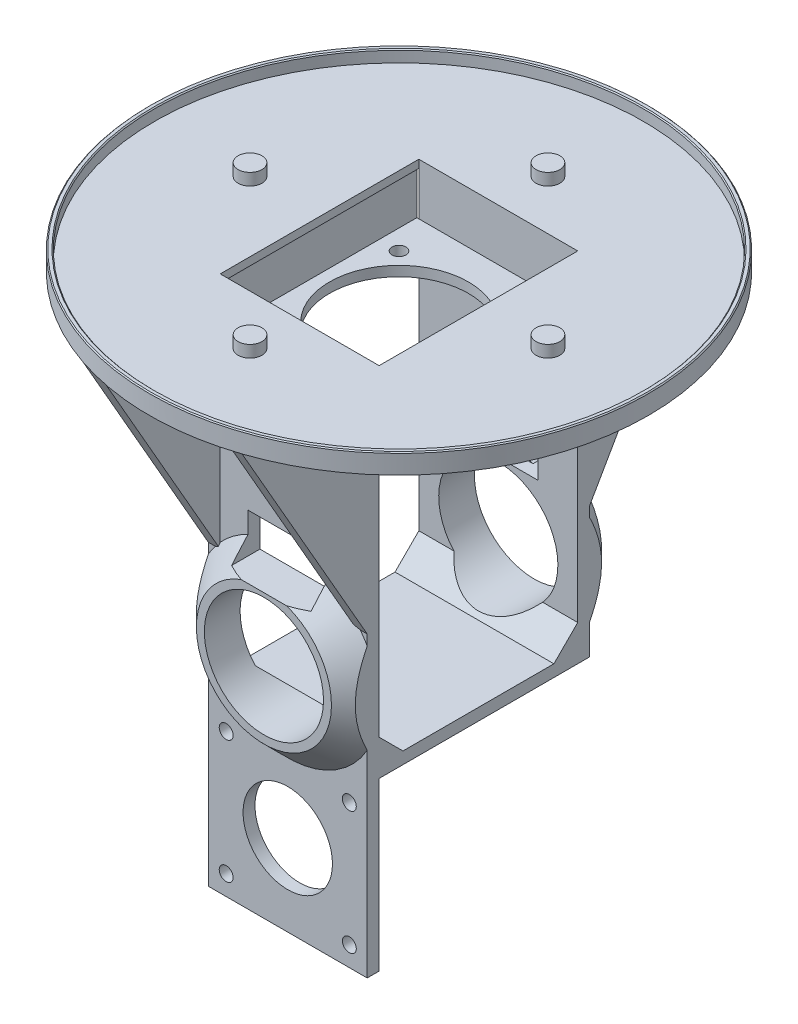
from build123d import *

# Parameters (mm, degrees)
SKETCH1_R            = 62.775
SKETCH1_R_2          = 2.75
BOSS_EXTRUDE1_DEPTH  = 2
SKETCH2_R            = 62.775
SKETCH2_R_2          = 61.525
SKETCH2_R_3          = 3
BOSS_EXTRUDE2_DEPTH  = 3
CHAMFER1_SIZE        = 0.25
BOSS_EXTRUDE3_START  = 25
SKETCH3_W            = 40
SKETCH3_H            = 130
BOSS_EXTRUDE3_DEPTH  = 3
CUT_EXTRUDE1_REACH   = 172.531
SKETCH4_R            = 1.75
SKETCH4_R_2          = 11.25
BOSS_EXTRUDE4_DEPTH  = 3
LPATTERN1_COUNT      = 2
LPATTERN1_PITCH      = 37
BOSS_EXTRUDE6_DEPTH  = 50
CUT_EXTRUDE2_REACH   = 148.471
SKETCH8_R            = 17.5
SKETCH8_R_2          = 1.75
CUT_EXTRUDE3_REACH   = 161.077
SKETCH9_W            = 40
SKETCH9_H            = 50
MIRROR1_COPY_1_DEPTH = 3
CUT_EXTRUDE4_REACH   = 172.531
SKETCH10_R           = 15
SKETCH10_W           = 40
SKETCH10_H           = 45
SKETCH11_W           = 40
SKETCH11_H           = 56
BOSS_EXTRUDE7_DEPTH  = 3
SKETCH12_R           = 15
CUT_EXTRUDE5_DEPTH   = 171.530939275
SKETCH13_R           = 17
SKETCH13_R_2         = 15
BOSS_EXTRUDE9_DEPTH  = 9
CHAMFER2_SIZE        = 6
SKETCH14_W           = 20
SKETCH14_H           = 10
CUT_EXTRUDE6_DEPTH   = 171.530939275
CHAMFER3_SIZE        = 6


with BuildPart() as part:
    # Sketch1 → Boss-Extrude1 (new body)
    with BuildSketch(Plane(origin=(0, 0, 0), x_dir=(1, 0, 0), z_dir=(0, 1, 0))):
        with Locations(Location((0, 0, 0), (0, 0, 270))):
            Circle(SKETCH1_R)
        with Locations(Location((0, 0, 0), (0, 0, 270))):
            Circle(SKETCH1_R_2, mode=Mode.SUBTRACT)
    extrude(amount=BOSS_EXTRUDE1_DEPTH)

    # Sketch2 → Boss-Extrude2 (add)
    # profile 1 of 5: a face of its own
    with BuildSketch(Plane(origin=(0, 2, 0), x_dir=(1, 0, 0), z_dir=(0, 1, 0))):
        with Locations(Location((0, 0, 0), (0, 0, 270))):
            Circle(SKETCH2_R)
        with Locations(Location((0, 0, 0), (0, 0, 270))):
            Circle(SKETCH2_R_2, mode=Mode.SUBTRACT)
    # profile 2 of 5: a face of its own
    with BuildSketch(Plane(origin=(0, 2, 0), x_dir=(1, 0, 0), z_dir=(0, 1, 0))):
        with Locations(Location((-37.5, 0, 0), (0, 0, 270))):
            Circle(SKETCH2_R_3)
    # profile 3 of 5: a face of its own
    with BuildSketch(Plane(origin=(0, 2, 0), x_dir=(1, 0, 0), z_dir=(0, 1, 0))):
        with Locations(Location((0, 37.5, 0), (0, 0, 270))):
            Circle(SKETCH2_R_3)
    # profile 4 of 5: a face of its own
    with BuildSketch(Plane(origin=(0, 2, 0), x_dir=(1, 0, 0), z_dir=(0, 1, 0))):
        with Locations(Location((37.5, 0, 0), (0, 0, 270))):
            Circle(SKETCH2_R_3)
    # profile 5 of 5: a face of its own
    with BuildSketch(Plane(origin=(0, 2, 0), x_dir=(1, 0, 0), z_dir=(0, 1, 0))):
        with Locations(Location((0, -37.5, 0), (0, 0, 270))):
            Circle(SKETCH2_R_3)
    extrude(amount=BOSS_EXTRUDE2_DEPTH)

    # Chamfer1
    chamfer1_edges = [part.edges().sort_by_distance(p)[0] for p in [
        (0, 5, -61.525),
        (0, 5, -62.775),
    ]]
    chamfer(chamfer1_edges, length=CHAMFER1_SIZE)

    # Sketch3 → Boss-Extrude3 (add)
    with BuildSketch(Plane.XY.offset(BOSS_EXTRUDE3_START)):
        with Locations((0, -65)):
            Rectangle(SKETCH3_W, SKETCH3_H)
    boss_extrude3 = extrude(amount=BOSS_EXTRUDE3_DEPTH)

    # Sketch4 → Cut-Extrude1 (cut, up to next)
    with BuildSketch(Plane.XY.offset(28), mode=Mode.PRIVATE) as cut_extrude1_sk1:
        with Locations((-15.5, -125)):
            Circle(SKETCH4_R)
    cut_extrude1_tool1 = extrude(cut_extrude1_sk1.sketch, amount=-CUT_EXTRUDE1_REACH, mode=Mode.PRIVATE) & part.part
    # Sketch4 → Cut-Extrude1 (cut, up to next)
    with BuildSketch(Plane.XY.offset(28), mode=Mode.PRIVATE) as cut_extrude1_sk2:
        with Locations((15.5, -125)):
            Circle(SKETCH4_R)
    cut_extrude1_tool2 = extrude(cut_extrude1_sk2.sketch, amount=-CUT_EXTRUDE1_REACH, mode=Mode.PRIVATE) & part.part
    # Sketch4 → Cut-Extrude1 (cut, up to next)
    with BuildSketch(Plane.XY.offset(28), mode=Mode.PRIVATE) as cut_extrude1_sk3:
        with Locations((15.5, -94)):
            Circle(SKETCH4_R)
    cut_extrude1_tool3 = extrude(cut_extrude1_sk3.sketch, amount=-CUT_EXTRUDE1_REACH, mode=Mode.PRIVATE) & part.part
    # Sketch4 → Cut-Extrude1 (cut, up to next)
    with BuildSketch(Plane.XY.offset(28), mode=Mode.PRIVATE) as cut_extrude1_sk4:
        with Locations((-15.5, -94)):
            Circle(SKETCH4_R)
    cut_extrude1_tool4 = extrude(cut_extrude1_sk4.sketch, amount=-CUT_EXTRUDE1_REACH, mode=Mode.PRIVATE) & part.part
    # Sketch4 → Cut-Extrude1 (cut, up to next)
    with BuildSketch(Plane.XY.offset(28), mode=Mode.PRIVATE) as cut_extrude1_sk5:
        with Locations((0, -109.5)):
            Circle(SKETCH4_R_2)
    cut_extrude1_tool5 = extrude(cut_extrude1_sk5.sketch, amount=-CUT_EXTRUDE1_REACH, mode=Mode.PRIVATE) & part.part
    add(cut_extrude1_tool1.solids().sort_by_distance((-15.5, -125, 28))[0], mode=Mode.SUBTRACT)
    add(cut_extrude1_tool2.solids().sort_by_distance((15.5, -125, 28))[0], mode=Mode.SUBTRACT)
    add(cut_extrude1_tool3.solids().sort_by_distance((15.5, -94, 28))[0], mode=Mode.SUBTRACT)
    add(cut_extrude1_tool4.solids().sort_by_distance((-15.5, -94, 28))[0], mode=Mode.SUBTRACT)
    add(cut_extrude1_tool5.solids().sort_by_distance((0, -109.5, 28))[0], mode=Mode.SUBTRACT)

    # Sketch5 → Boss-Extrude4 (add)
    with BuildSketch(Plane(origin=(20, 0, 0), x_dir=(0, 0, -1), z_dir=(1, 0, 0))):
        Polygon((-59.503786644, 0), (-28, 0), (-28, -55), align=None)
    boss_extrude4 = extrude(amount=-BOSS_EXTRUDE4_DEPTH)

    # LPattern1: Boss-Extrude4 ×2
    with Locations(*[(-i * LPATTERN1_PITCH, 0, 0) for i in range(1, LPATTERN1_COUNT)]):
        add(boss_extrude4)

    # Sketch7 → Boss-Extrude6 (add)
    with BuildSketch(Plane(origin=(0, 0, 25), x_dir=(-1, 0, 0), z_dir=(0, 0, -1))):
        Polygon((-22.5, -13.5), (22.5, -13.5), (22.5, 0), (20.5, 0), (20.5, -11), (-20.5, -11), (-20.5, 0), (-22.5, 0), align=None)
    extrude(amount=BOSS_EXTRUDE6_DEPTH)

    # Sketch8 → Cut-Extrude2 (cut, up to next)
    with BuildSketch(Plane.XZ.offset(13.5), mode=Mode.PRIVATE) as cut_extrude2_sk1:
        Circle(SKETCH8_R)
    cut_extrude2_tool1 = extrude(cut_extrude2_sk1.sketch, amount=-CUT_EXTRUDE2_REACH, mode=Mode.PRIVATE) & part.part
    # Sketch8 → Cut-Extrude2 (cut, up to next)
    with BuildSketch(Plane.XZ.offset(13.5), mode=Mode.PRIVATE) as cut_extrude2_sk2:
        with Locations((15.5, 15.5)):
            Circle(SKETCH8_R_2)
    cut_extrude2_tool2 = extrude(cut_extrude2_sk2.sketch, amount=-CUT_EXTRUDE2_REACH, mode=Mode.PRIVATE) & part.part
    # Sketch8 → Cut-Extrude2 (cut, up to next)
    with BuildSketch(Plane.XZ.offset(13.5), mode=Mode.PRIVATE) as cut_extrude2_sk3:
        with Locations((-15.5, 15.5)):
            Circle(SKETCH8_R_2)
    cut_extrude2_tool3 = extrude(cut_extrude2_sk3.sketch, amount=-CUT_EXTRUDE2_REACH, mode=Mode.PRIVATE) & part.part
    # Sketch8 → Cut-Extrude2 (cut, up to next)
    with BuildSketch(Plane.XZ.offset(13.5), mode=Mode.PRIVATE) as cut_extrude2_sk4:
        with Locations((-15.5, -15.5)):
            Circle(SKETCH8_R_2)
    cut_extrude2_tool4 = extrude(cut_extrude2_sk4.sketch, amount=-CUT_EXTRUDE2_REACH, mode=Mode.PRIVATE) & part.part
    # Sketch8 → Cut-Extrude2 (cut, up to next)
    with BuildSketch(Plane.XZ.offset(13.5), mode=Mode.PRIVATE) as cut_extrude2_sk5:
        with Locations((15.5, -15.5)):
            Circle(SKETCH8_R_2)
    cut_extrude2_tool5 = extrude(cut_extrude2_sk5.sketch, amount=-CUT_EXTRUDE2_REACH, mode=Mode.PRIVATE) & part.part
    add(cut_extrude2_tool1.solids().sort_by_distance((0, -13.5, 0))[0], mode=Mode.SUBTRACT)
    add(cut_extrude2_tool2.solids().sort_by_distance((15.5, -13.5, 15.5))[0], mode=Mode.SUBTRACT)
    add(cut_extrude2_tool3.solids().sort_by_distance((-15.5, -13.5, 15.5))[0], mode=Mode.SUBTRACT)
    add(cut_extrude2_tool4.solids().sort_by_distance((-15.5, -13.5, -15.5))[0], mode=Mode.SUBTRACT)
    add(cut_extrude2_tool5.solids().sort_by_distance((15.5, -13.5, -15.5))[0], mode=Mode.SUBTRACT)

    # Sketch9 → Cut-Extrude3 (cut, up to next)
    with BuildSketch(Plane(origin=(0, 2, 0), x_dir=(1, 0, 0), z_dir=(0, 1, 0)), mode=Mode.PRIVATE) as cut_extrude3_sk1:
        Rectangle(SKETCH9_W, SKETCH9_H)
    cut_extrude3_tool1 = extrude(cut_extrude3_sk1.sketch, amount=-CUT_EXTRUDE3_REACH, mode=Mode.PRIVATE) & part.part
    add(cut_extrude3_tool1.solids().sort_by_distance((0, 2, 0))[0], mode=Mode.SUBTRACT)

    # Mirror1: Boss-Extrude3, Boss-Extrude4 across plane
    add(boss_extrude3.mirror(Plane.XY))
    add(boss_extrude4.mirror(Plane.XY))

    # Mirror1 copy 1 sketch → Mirror1 copy 1 (add)
    with BuildSketch(Plane(origin=(-17, 0, 0), x_dir=(0, 0, 1), z_dir=(1, 0, 0))):
        Polygon((-59.503786644, 0), (-28, 0), (-28, 55), align=None)
    extrude(amount=-MIRROR1_COPY_1_DEPTH)

    # Sketch10 → Cut-Extrude4 (cut, up to next)
    with BuildSketch(Plane(origin=(0, 0, -28), x_dir=(-1, 0, 0), z_dir=(0, 0, -1)), mode=Mode.PRIVATE) as cut_extrude4_sk1:
        with Locations((0, -69)):
            Circle(SKETCH10_R)
    cut_extrude4_tool1 = extrude(cut_extrude4_sk1.sketch, amount=-CUT_EXTRUDE4_REACH, mode=Mode.PRIVATE) & part.part
    # Sketch10 → Cut-Extrude4 (cut, up to next)
    with BuildSketch(Plane(origin=(0, 0, -28), x_dir=(-1, 0, 0), z_dir=(0, 0, -1)), mode=Mode.PRIVATE) as cut_extrude4_sk2:
        with Locations((0, -107.5)):
            Rectangle(SKETCH10_W, SKETCH10_H)
    cut_extrude4_tool2 = extrude(cut_extrude4_sk2.sketch, amount=-CUT_EXTRUDE4_REACH, mode=Mode.PRIVATE) & part.part
    add(cut_extrude4_tool1.solids().sort_by_distance((0, -69, -28))[0], mode=Mode.SUBTRACT)
    add(cut_extrude4_tool2.solids().sort_by_distance((0, -107.5, -28))[0], mode=Mode.SUBTRACT)

    # Sketch11 → Boss-Extrude7 (add)
    with BuildSketch(Plane.XZ.offset(85)):
        Rectangle(SKETCH11_W, SKETCH11_H)
    extrude(amount=BOSS_EXTRUDE7_DEPTH)

    # Sketch12 → Cut-Extrude5 (cut, through all)
    with BuildSketch(Plane.XY.offset(28)):
        with Locations(Location((0, -69, 0), (0, 0, 180))):
            Circle(SKETCH12_R)
    extrude(amount=-CUT_EXTRUDE5_DEPTH, mode=Mode.SUBTRACT)

    # Sketch13 → Boss-Extrude9 (add)
    with BuildSketch(Plane.XY.offset(-25)):
        with Locations((0, -69)):
            Circle(SKETCH13_R)
        with Locations(Location((0, -69, 0), (0, 0, 180))):
            Circle(SKETCH13_R_2, mode=Mode.SUBTRACT)
    boss_extrude9 = extrude(amount=-BOSS_EXTRUDE9_DEPTH)

    # Mirror2: Boss-Extrude9 across plane
    add(boss_extrude9.mirror(Plane.XY))

    # Chamfer2
    # the kernel refuses this chamfer: 6 mm, written as the material it adds along each edge
    with BuildSketch(Plane(origin=(20, -85, -25), x_dir=(0, 0, 1), z_dir=(-1, 0, 0))) as chamfer2_piece_1_section:
        Polygon((CHAMFER2_SIZE, 0), (0, CHAMFER2_SIZE), (0, 0), align=None)
    chamfer2_piece_1 = extrude(amount=40, mode=Mode.PRIVATE)
    chamfer2_piece_1 = chamfer2_piece_1 - Plane(origin=(0, -69, -25), x_dir=(-1, 0, 0), z_dir=(0, 0, -1)) * Cylinder(15, 104, mode=Mode.PRIVATE)
    add(chamfer2_piece_1)
    with BuildSketch(Plane(origin=(20, -85, 25), x_dir=(0, 1, 0), z_dir=(-1, 0, 0))) as chamfer2_piece_2_section:
        Polygon((CHAMFER2_SIZE, 0), (0, CHAMFER2_SIZE), (0, 0), align=None)
    chamfer2_piece_2 = extrude(amount=40, mode=Mode.PRIVATE)
    chamfer2_piece_2 = chamfer2_piece_2 - Plane(origin=(0, -69, 25), x_dir=(-1, 0, 0), z_dir=(0, 0, -1)) * Cylinder(15, 105, mode=Mode.PRIVATE)
    add(chamfer2_piece_2)

    # Sketch14 → Cut-Extrude6 (cut, through all)
    with BuildSketch(Plane(origin=(0, 0, -28), x_dir=(-1, 0, 0), z_dir=(0, 0, -1))):
        with Locations((0, -48)):
            Rectangle(SKETCH14_W, SKETCH14_H)
    extrude(amount=-CUT_EXTRUDE6_DEPTH, mode=Mode.SUBTRACT)

    # Chamfer3
    # the kernel refuses this chamfer: 6 mm, written as the material it adds along each edge
    with BuildSketch(Plane(origin=(0, -69, -28), x_dir=(0.536071035428074, 0.8441728762374877, 0), z_dir=(0.8441728762374877, -0.536071035428074, 0))) as chamfer3_piece_1_section:
        Polygon((17 + CHAMFER3_SIZE, 0), (17, -CHAMFER3_SIZE), (17, 0), align=None)
    chamfer3_piece_1 = revolve(axis=Axis((0, -69, -28), (0, 0, 1)), revolution_arc=302.416575588, mode=Mode.PRIVATE)
    chamfer3_piece_1 = split(chamfer3_piece_1, bisect_by=Plane(origin=(20, -69, -28), z_dir=(-1, 0, 0)), keep=Keep.TOP, mode=Mode.PRIVATE)
    chamfer3_piece_1 = split(chamfer3_piece_1, bisect_by=Plane(origin=(0, -88, -28), z_dir=(0, 1, 0)), keep=Keep.TOP, mode=Mode.PRIVATE)
    chamfer3_piece_1 = split(chamfer3_piece_1, bisect_by=Plane(origin=(10, -69, -28), z_dir=(1, 0, 0)), keep=Keep.TOP, mode=Mode.PRIVATE)
    add(chamfer3_piece_1)
    with BuildSketch(Plane(origin=(0, -69, -28), x_dir=(0.536071035428074, 0.8441728762374877, 0), z_dir=(0.8441728762374877, -0.536071035428074, 0))) as chamfer3_piece_2_section:
        Polygon((17 + CHAMFER3_SIZE, 0), (17, -CHAMFER3_SIZE), (17, 0), align=None)
    chamfer3_piece_2 = revolve(axis=Axis((0, -69, -28), (0, 0, 1)), revolution_arc=302.416575588, mode=Mode.PRIVATE)
    chamfer3_piece_2 = split(chamfer3_piece_2, bisect_by=Plane(origin=(-20, -69, -28), z_dir=(1, 0, 0)), keep=Keep.TOP, mode=Mode.PRIVATE)
    chamfer3_piece_2 = split(chamfer3_piece_2, bisect_by=Plane(origin=(0, -88, -28), z_dir=(0, 1, 0)), keep=Keep.TOP, mode=Mode.PRIVATE)
    chamfer3_piece_2 = split(chamfer3_piece_2, bisect_by=Plane(origin=(-10, -69, -28), z_dir=(-1, 0, 0)), keep=Keep.TOP, mode=Mode.PRIVATE)
    add(chamfer3_piece_2)
    with BuildSketch(Plane(origin=(0, -69, -28), x_dir=(0.536071035428074, 0.8441728762374877, 0), z_dir=(0.8441728762374877, -0.536071035428074, 0))) as chamfer3_piece_3_section:
        Polygon((17 + CHAMFER3_SIZE, 0), (17, -CHAMFER3_SIZE), (17, 0), align=None)
    chamfer3_piece_3 = revolve(axis=Axis((0, -69, -28), (0, 0, 1)), revolution_arc=302.416575588, mode=Mode.PRIVATE)
    chamfer3_piece_3 = split(chamfer3_piece_3, bisect_by=Plane(origin=(0, -88, -28), z_dir=(0, 1, 0)), keep=Keep.TOP, mode=Mode.PRIVATE)
    chamfer3_piece_3 = split(chamfer3_piece_3, bisect_by=Plane(origin=(10, -69, -28), z_dir=(-1, 0, 0)), keep=Keep.TOP, mode=Mode.PRIVATE)
    chamfer3_piece_3 = split(chamfer3_piece_3, bisect_by=Plane(origin=(0, -53, -28), z_dir=(0, -1, 0)), keep=Keep.TOP, mode=Mode.PRIVATE)
    chamfer3_piece_3 = split(chamfer3_piece_3, bisect_by=Plane(origin=(-17, -69, -28), z_dir=(1, 0, 0)), keep=Keep.TOP, mode=Mode.PRIVATE)
    add(chamfer3_piece_3)
    with BuildSketch(Plane(origin=(0, -69, 28), x_dir=(1, 0, 0), z_dir=(0, 1, 0))) as chamfer3_piece_4_section:
        Polygon((17 + CHAMFER3_SIZE, 0), (17, -CHAMFER3_SIZE), (17, 0), align=None)
    chamfer3_piece_4 = revolve(axis=Axis((0, -69, 28), (0, 0, -1)), revolution_arc=338.933124457, mode=Mode.PRIVATE)
    chamfer3_piece_4 = split(chamfer3_piece_4, bisect_by=Plane(origin=(20, -69, 28), z_dir=(-1, 0, 0)), keep=Keep.TOP, mode=Mode.PRIVATE)
    chamfer3_piece_4 = split(chamfer3_piece_4, bisect_by=Plane(origin=(-20, -69, 28), z_dir=(1, 0, 0)), keep=Keep.TOP, mode=Mode.PRIVATE)
    chamfer3_piece_4 = split(chamfer3_piece_4, bisect_by=Plane(origin=(0, -53, 28), z_dir=(0, -1, 0)), keep=Keep.TOP, mode=Mode.PRIVATE)
    add(chamfer3_piece_4)
    with BuildSketch(Plane(origin=(0, -69, 28), x_dir=(1, 0, 0), z_dir=(0, 1, 0))) as chamfer3_piece_5_section:
        Polygon((17 + CHAMFER3_SIZE, 0), (17, -CHAMFER3_SIZE), (17, 0), align=None)
    chamfer3_piece_5 = revolve(axis=Axis((0, -69, 28), (0, 0, -1)), revolution_arc=338.933124457, mode=Mode.PRIVATE)
    chamfer3_piece_5 = split(chamfer3_piece_5, bisect_by=Plane(origin=(-10, -69, 28), z_dir=(-1, 0, 0)), keep=Keep.TOP, mode=Mode.PRIVATE)
    chamfer3_piece_5 = split(chamfer3_piece_5, bisect_by=Plane(origin=(-17, -69, 28), z_dir=(1, 0, 0)), keep=Keep.TOP, mode=Mode.PRIVATE)
    add(chamfer3_piece_5)
    with BuildSketch(Plane(origin=(0, -69, 28), x_dir=(1, 0, 0), z_dir=(0, 1, 0))) as chamfer3_piece_6_section:
        Polygon((17 + CHAMFER3_SIZE, 0), (17, -CHAMFER3_SIZE), (17, 0), align=None)
    chamfer3_piece_6 = revolve(axis=Axis((0, -69, 28), (0, 0, -1)), revolution_arc=338.933124457, mode=Mode.PRIVATE)
    chamfer3_piece_6 = split(chamfer3_piece_6, bisect_by=Plane(origin=(10, -69, 28), z_dir=(1, 0, 0)), keep=Keep.TOP, mode=Mode.PRIVATE)
    chamfer3_piece_6 = split(chamfer3_piece_6, bisect_by=Plane(origin=(17, -69, 28), z_dir=(-1, 0, 0)), keep=Keep.TOP, mode=Mode.PRIVATE)
    add(chamfer3_piece_6)
    with BuildSketch(Plane(origin=(0, -69, 28), x_dir=(-0.9315622234238619, 0.3635819355930528, 0), z_dir=(-0.3635819355930528, -0.9315622234238619, 0))) as chamfer3_piece_7_section:
        Polygon((17 + CHAMFER3_SIZE, 0), (17, -CHAMFER3_SIZE), (17, 0), align=None)
    chamfer3_piece_7 = revolve(axis=Axis((0, -69, 28), (0, 0, -1)), revolution_arc=158.679661374, mode=Mode.PRIVATE)
    chamfer3_piece_7 = split(chamfer3_piece_7, bisect_by=Plane(origin=(20, -69, 28), z_dir=(-1, 0, 0)), keep=Keep.TOP, mode=Mode.PRIVATE)
    chamfer3_piece_7 = split(chamfer3_piece_7, bisect_by=Plane(origin=(-20, -69, 28), z_dir=(1, 0, 0)), keep=Keep.TOP, mode=Mode.PRIVATE)
    chamfer3_piece_7 = split(chamfer3_piece_7, bisect_by=Plane(origin=(0, -53, 28), z_dir=(0, -1, 0)), keep=Keep.TOP, mode=Mode.PRIVATE)
    add(chamfer3_piece_7)
    with BuildSketch(Plane(origin=(0, -69, 28), x_dir=(-0.9315622234238619, 0.3635819355930528, 0), z_dir=(-0.3635819355930528, -0.9315622234238619, 0))) as chamfer3_piece_8_section:
        Polygon((17 + CHAMFER3_SIZE, 0), (17, -CHAMFER3_SIZE), (17, 0), align=None)
    chamfer3_piece_8 = revolve(axis=Axis((0, -69, 28), (0, 0, -1)), revolution_arc=158.679661374, mode=Mode.PRIVATE)
    chamfer3_piece_8 = split(chamfer3_piece_8, bisect_by=Plane(origin=(-10, -69, 28), z_dir=(-1, 0, 0)), keep=Keep.TOP, mode=Mode.PRIVATE)
    chamfer3_piece_8 = split(chamfer3_piece_8, bisect_by=Plane(origin=(-17, -69, 28), z_dir=(1, 0, 0)), keep=Keep.TOP, mode=Mode.PRIVATE)
    add(chamfer3_piece_8)
    with BuildSketch(Plane(origin=(0, -69, 28), x_dir=(-0.9315622234238619, 0.3635819355930528, 0), z_dir=(-0.3635819355930528, -0.9315622234238619, 0))) as chamfer3_piece_9_section:
        Polygon((17 + CHAMFER3_SIZE, 0), (17, -CHAMFER3_SIZE), (17, 0), align=None)
    chamfer3_piece_9 = revolve(axis=Axis((0, -69, 28), (0, 0, -1)), revolution_arc=158.679661374, mode=Mode.PRIVATE)
    chamfer3_piece_9 = split(chamfer3_piece_9, bisect_by=Plane(origin=(10, -69, 28), z_dir=(1, 0, 0)), keep=Keep.TOP, mode=Mode.PRIVATE)
    chamfer3_piece_9 = split(chamfer3_piece_9, bisect_by=Plane(origin=(17, -69, 28), z_dir=(-1, 0, 0)), keep=Keep.TOP, mode=Mode.PRIVATE)
    add(chamfer3_piece_9)
    with BuildSketch(Plane(origin=(0, -69, -28), x_dir=(1, 0, 0), z_dir=(0, -1, 0))) as chamfer3_piece_10_section:
        Polygon((17 + CHAMFER3_SIZE, 0), (17, -CHAMFER3_SIZE), (17, 0), align=None)
    chamfer3_piece_10 = revolve(axis=Axis((0, -69, -28), (0, 0, 1)), revolution_arc=122.267479657, mode=Mode.PRIVATE)
    chamfer3_piece_10 = split(chamfer3_piece_10, bisect_by=Plane(origin=(20, -69, -28), z_dir=(-1, 0, 0)), keep=Keep.TOP, mode=Mode.PRIVATE)
    chamfer3_piece_10 = split(chamfer3_piece_10, bisect_by=Plane(origin=(0, -53, -28), z_dir=(0, -1, 0)), keep=Keep.TOP, mode=Mode.PRIVATE)
    add(chamfer3_piece_10)
    with BuildSketch(Plane(origin=(0, -69, -28), x_dir=(1, 0, 0), z_dir=(0, -1, 0))) as chamfer3_piece_11_section:
        Polygon((17 + CHAMFER3_SIZE, 0), (17, -CHAMFER3_SIZE), (17, 0), align=None)
    chamfer3_piece_11 = revolve(axis=Axis((0, -69, -28), (0, 0, 1)), revolution_arc=122.267479657, mode=Mode.PRIVATE)
    chamfer3_piece_11 = split(chamfer3_piece_11, bisect_by=Plane(origin=(10, -69, -28), z_dir=(1, 0, 0)), keep=Keep.TOP, mode=Mode.PRIVATE)
    chamfer3_piece_11 = split(chamfer3_piece_11, bisect_by=Plane(origin=(17, -69, -28), z_dir=(-1, 0, 0)), keep=Keep.TOP, mode=Mode.PRIVATE)
    add(chamfer3_piece_11)
    with BuildSketch(Plane(origin=(0, -69, -28), x_dir=(1, 0, 0), z_dir=(0, -1, 0))) as chamfer3_piece_12_section:
        Polygon((17 + CHAMFER3_SIZE, 0), (17, -CHAMFER3_SIZE), (17, 0), align=None)
    chamfer3_piece_12 = revolve(axis=Axis((0, -69, -28), (0, 0, 1)), revolution_arc=122.267479657, mode=Mode.PRIVATE)
    chamfer3_piece_12 = split(chamfer3_piece_12, bisect_by=Plane(origin=(-10, -69, -28), z_dir=(-1, 0, 0)), keep=Keep.TOP, mode=Mode.PRIVATE)
    add(chamfer3_piece_12)


solid = part.part
